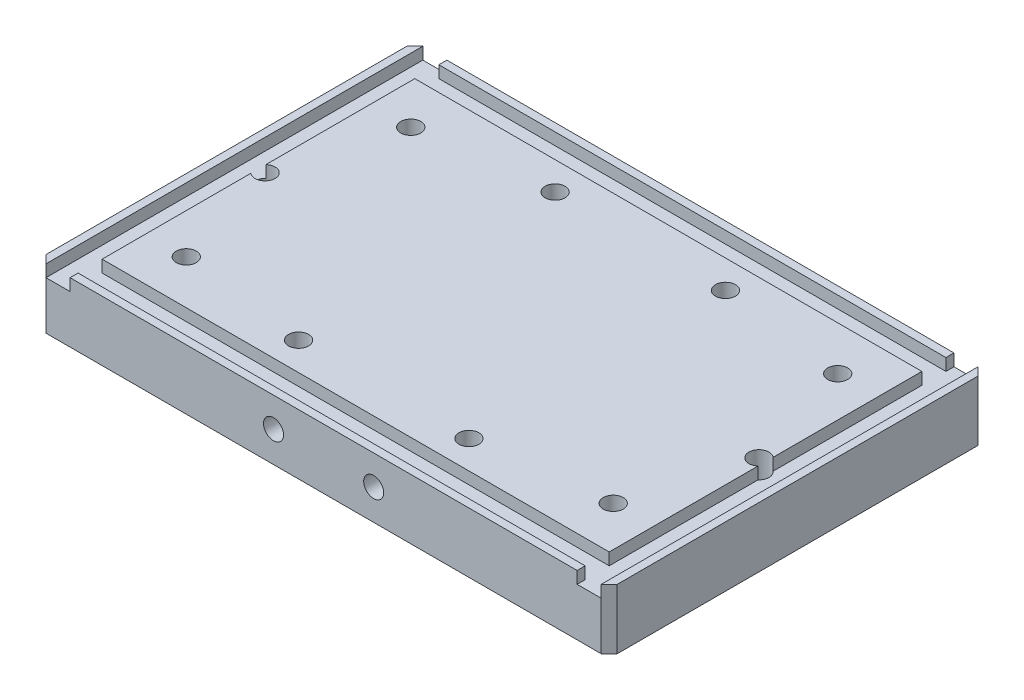
from build123d import *

# Parameters (mm, degrees)
SKETCH1_W           = 142.5
SKETCH1_H           = 94
BOSS_EXTRUDE1_DEPTH = 15
SKETCH2_W           = 126.5
SKETCH2_H           = 78
CUT_EXTRUDE2_DEPTH  = 3
SKETCH3_R           = 2.5
CUT_EXTRUDE3_DEPTH  = 172.368754445
CHAMFER1_SIZE       = 2
SKETCH4_R           = 2.5
CUT_EXTRUDE6_DEPTH  = 172.368754445
SKETCH6_R           = 2.5
CUT_EXTRUDE7_DEPTH  = 172.368754445
SKETCH7_R           = 2.5
CUT_EXTRUDE8_DEPTH  = 5


with BuildPart() as part:
    # Sketch1 → Boss-Extrude1 (new body)
    with BuildSketch(Plane(origin=(0, 0, 0), x_dir=(1, 0, 0), z_dir=(0, 1, 0))):
        with Locations((71.25, 47)):
            Rectangle(SKETCH1_W, SKETCH1_H)
    extrude(amount=BOSS_EXTRUDE1_DEPTH)

    # Sketch2 → Cut-Extrude2 (cut)
    with BuildSketch(Plane(origin=(0, 15, 0), x_dir=(1, 0, 0), z_dir=(0, 1, 0))):
        Polygon((134.5, 92), (8, 92), (8, 94), (2, 94), (2, 0), (8, 0), (8, 2), (134.5, 2), (134.5, 0), (140.5, 0), (140.5, 94), (134.5, 94), align=None)
        with Locations((71.25, 47)):
            Rectangle(SKETCH2_W, SKETCH2_H, mode=Mode.SUBTRACT)
    extrude(amount=-CUT_EXTRUDE2_DEPTH, mode=Mode.SUBTRACT)

    # Sketch3 → Cut-Extrude3 (cut, through all)
    with BuildSketch(Plane(origin=(0, 15, 0), x_dir=(1, 0, 0), z_dir=(0, 1, 0))):
        with Locations(Location((9.65, 47, 0), (0, 0, 270))):
            Circle(SKETCH3_R)
        with Locations(Location((132.85, 47, 0), (0, 0, 270))):
            Circle(SKETCH3_R)
    extrude(amount=-CUT_EXTRUDE3_DEPTH, mode=Mode.SUBTRACT)

    # Chamfer1
    chamfer1_edges = [part.edges().sort_by_distance(p)[0] for p in [
        (0, 7.5, 0),
        (0, 7.5, -94),
        (142.5, 7.5, -94),
        (142.5, 7.5, 0),
    ]]
    chamfer(chamfer1_edges, length=CHAMFER1_SIZE - 0.0001)  # a hair under: the kernel refuses the full size

    # Sketch4 → Cut-Extrude6 (cut, through all)
    with BuildSketch(Plane(origin=(0, 15, 0), x_dir=(1, 0, 0), z_dir=(0, 1, 0))):
        with Locations(Location((50, 79, 0), (0, 0, 270))):
            Circle(SKETCH4_R)
        with Locations(Location((92.5, 79, 0), (0, 0, 270))):
            Circle(SKETCH4_R)
        with Locations(Location((50, 15, 0), (0, 0, 270))):
            Circle(SKETCH4_R)
        with Locations(Location((92.5, 15, 0), (0, 0, 270))):
            Circle(SKETCH4_R)
    extrude(amount=-CUT_EXTRUDE6_DEPTH, mode=Mode.SUBTRACT)

    # Sketch6 → Cut-Extrude7 (cut, through all)
    with BuildSketch(Plane(origin=(0, 15, 0), x_dir=(1, 0, 0), z_dir=(0, 1, 0))):
        with Locations(Location((124.5, 75, 0), (0, 0, 270))):
            Circle(SKETCH6_R)
        with Locations(Location((18, 75, 0), (0, 0, 270))):
            Circle(SKETCH6_R)
        with Locations(Location((18, 19, 0), (0, 0, 270))):
            Circle(SKETCH6_R)
        with Locations(Location((124.5, 19, 0), (0, 0, 270))):
            Circle(SKETCH6_R)
    extrude(amount=-CUT_EXTRUDE7_DEPTH, mode=Mode.SUBTRACT)

    # Sketch7 → Cut-Extrude8 (cut)
    with BuildSketch(Plane.XY):
        with Locations((58.75, 7.646221832)):
            Circle(SKETCH7_R)
        with Locations((83.75, 7.646221832)):
            Circle(SKETCH7_R)
    extrude(amount=-CUT_EXTRUDE8_DEPTH, mode=Mode.SUBTRACT)


solid = part.part
